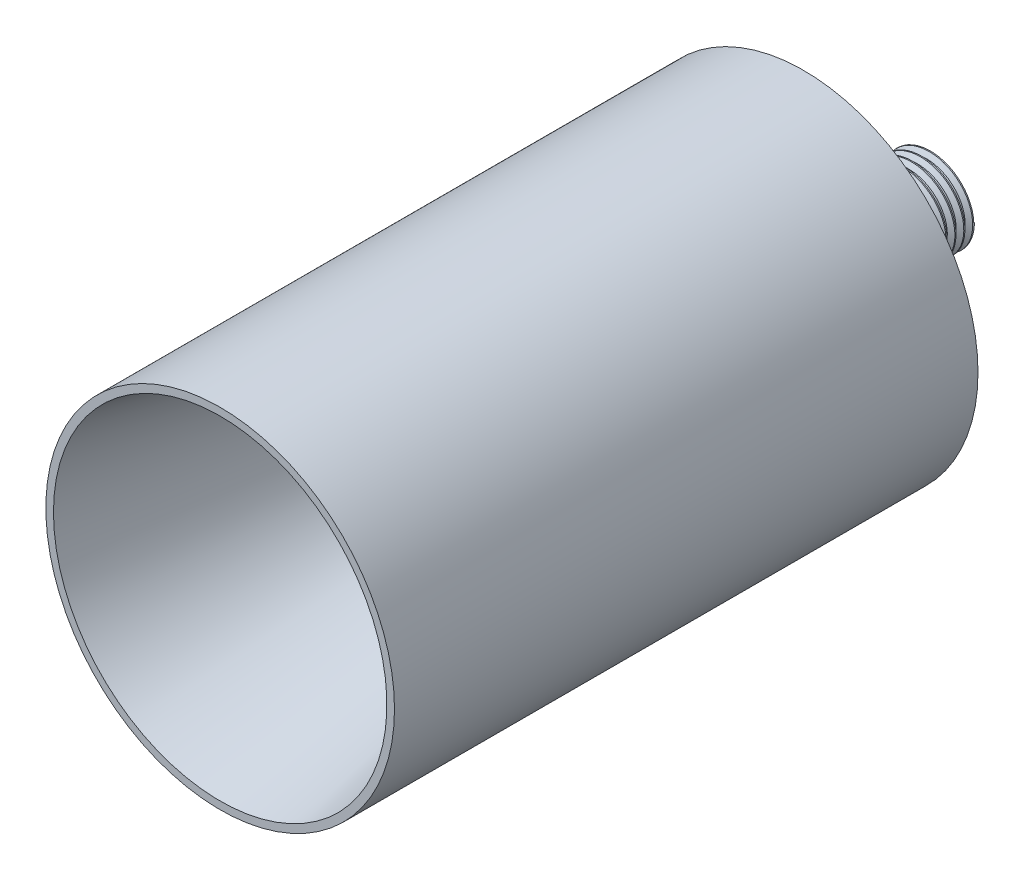
from build123d import *

# Parameters (mm, degrees)
SKETCH1_R           = 6
SKETCH1_R_2         = 5
BOSS_EXTRUDE1_DEPTH = 18
SKETCH2_R           = 24.5
SKETCH2_R_2         = 5
BOSS_EXTRUDE2_DEPTH = 82
SKETCH4_R           = 6
CUT_EXTRUDE1_DEPTH  = 82
CUT_EXTRUDE1_DRAFT  = 12
THREAD1_PITCH       = 1.25


with BuildPart() as part:
    # Sketch1 → Boss-Extrude1 (new body)
    with BuildSketch(Plane.XY):
        Circle(SKETCH1_R)
        Circle(SKETCH1_R_2, mode=Mode.SUBTRACT)
    extrude(amount=BOSS_EXTRUDE1_DEPTH)

    # Sketch2 → Boss-Extrude2 (add)
    with BuildSketch(Plane.XY.offset(18)):
        Circle(SKETCH2_R)
        Circle(SKETCH2_R_2, mode=Mode.SUBTRACT)
    extrude(amount=BOSS_EXTRUDE2_DEPTH)


with BuildPart() as cut_extrude1_tool:
    # Sketch4 → Cut-Extrude1 (with draft: the straight prism first)
    with BuildSketch(Plane(origin=(0, 0, 18), x_dir=(-1, 0, 0), z_dir=(0, 0, -1))):
        Circle(SKETCH4_R)
    extrude(amount=-CUT_EXTRUDE1_DEPTH)
    # Cut-Extrude1: the draft: its side faces are tilted about the plane it starts from
    cut_extrude1_sides = [cut_extrude1_tool.faces().sort_by_distance(p)[0] for p in [
        (6, 0, 59),
    ]]
    draft(cut_extrude1_sides, Plane(origin=(0, 0, 18), x_dir=(-1, 0, 0), z_dir=(0, 0, -1)), CUT_EXTRUDE1_DRAFT)


with BuildPart() as part_1:
    add(part.part)

    # Cut-Extrude1: cut by cut_extrude1_tool
    add(cut_extrude1_tool.part, mode=Mode.SUBTRACT)


with BuildPart() as cut_extrude1_piece_1:
    # of the separate pieces the step leaves, piece 1, a body of its own (cut_extrude1_pieces)
    add(part_1.part.solids().sort_by_distance((24.5, 0, 18))[0])


with BuildPart() as cut_extrude1_piece_2:
    # of the separate pieces the step leaves, piece 2, a body of its own (cut_extrude1_pieces)
    add(part_1.part.solids().sort_by_distance((6, 0, 0))[0])

    # Thread1: the profile of Thread Profile1 profile screwed along a right-hand helix of 15.2 turns, 8 arcs to a turn; built about Z, then put on its axis
    thread1_z = Axis((0, 0, 0), (0, 0, 1))
    thread1_corners = [(6.0003, 0, -0.000173205), (6.0003, 0, 1.093923202), (5.323417656, 0, 0.703124998), (5.323417656, 0, 0.390624998)]
    with BuildLine(mode=Mode.PRIVATE) as thread1_profile:
        Line(thread1_corners[0], thread1_corners[1])
        Line(thread1_corners[1], thread1_corners[2])
        Line(thread1_corners[2], thread1_corners[3])
        Line(thread1_corners[3], thread1_corners[0])
    thread1_cap = Face(thread1_profile.wire())
    thread1_turn_angles = [0, 22.5, 45, 67.5, 90, 112.5, 135, 157.5, 180, 202.5, 225, 247.5, 270, 292.5, 315, 337.5, 360]
    thread1_turn_weights = [1, 0.9238795325112867, 1, 0.9238795325112867, 1, 0.9238795325112867, 1, 0.9238795325112867, 1, 0.9238795325112867, 1, 0.9238795325112867, 1, 0.9238795325112867, 1, 0.9238795325112867, 1]
    thread1_turn_rails = [Edge.make_bspline([Vector(p[0], p[1], 0).rotate(thread1_z, thread1_turn_angles[k]) / thread1_turn_weights[k] + Vector(0, 0, p[2] + THREAD1_PITCH * thread1_turn_angles[k] / 360) for k in range(17)], [0, 0, 0, 1, 1, 2, 2, 3, 3, 4, 4, 5, 5, 6, 6, 7, 7, 8, 8, 8], 2, thread1_turn_weights) for p in thread1_corners]
    thread1_turn_sides = [Face.make_surface_from_curves(thread1_turn_rails[p[0]], thread1_turn_rails[p[1]]) for p in [(0, 1), (1, 2), (2, 3), (3, 0)]]
    thread1_last_angles = [5400, 5422.5, 5445, 5458.5, 5472]
    thread1_last_weights = [1, 0.9238795325112867, 1, 0.9723699203976748, 1]
    thread1_last_rails = [Edge.make_bspline([Vector(p[0], p[1], 0).rotate(thread1_z, thread1_last_angles[k]) / thread1_last_weights[k] + Vector(0, 0, p[2] + THREAD1_PITCH * thread1_last_angles[k] / 360) for k in range(5)], [0, 0, 0, 1, 1, 2, 2, 2], 2, thread1_last_weights) for p in thread1_corners]
    thread1_last_sides = [Face.make_surface_from_curves(thread1_last_rails[p[0]], thread1_last_rails[p[1]]) for p in [(0, 1), (1, 2), (2, 3), (3, 0)]]
    thread1 = Plane(origin=(0, 0, -1), x_dir=(1, 0, 0), z_dir=(0, 0, 1)) * Solid(Shell([*[p.moved(Location((0, 0, THREAD1_PITCH * i))) for i in range(15) for p in thread1_turn_sides], *thread1_last_sides, thread1_cap, thread1_cap.rotate(thread1_z, 5472).moved(Location((0, 0, THREAD1_PITCH * 5472 / 360)))]))
    add(thread1, mode=Mode.SUBTRACT)


solid = Compound([cut_extrude1_piece_1.part, cut_extrude1_piece_2.part])
